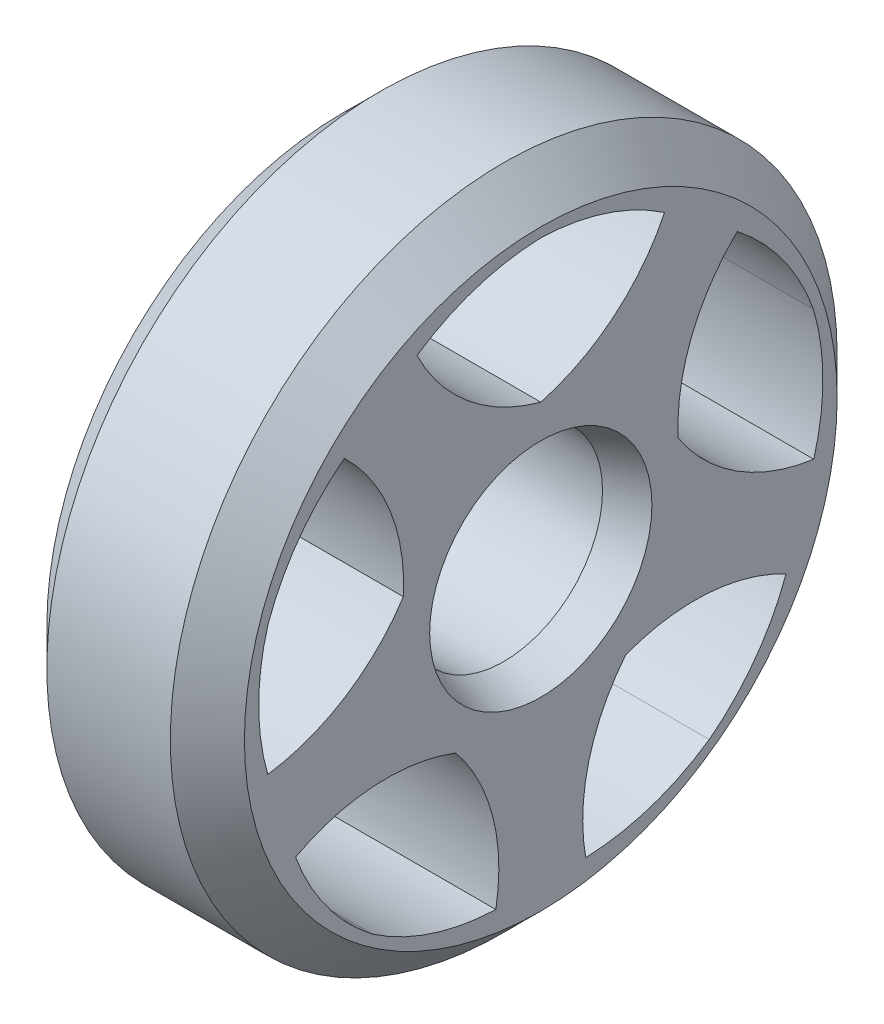
from build123d import *

# Parameters (mm, degrees)
SKETCH1_R           = 13.5
SKETCH1_R_2         = 4
BOSS_EXTRUDE1_DEPTH = 4
CUT_EXTRUDE1_DEPTH  = 20.506409203
CIRPATTERN1_COUNT   = 5
CHAMFER1_SIZE       = 1.5
CHAMFER2_SIZE       = 0.5
CHAMFER2_SIZE2      = 1.5


with BuildPart() as part:
    # Sketch1 → Boss-Extrude1 (new, symmetric)
    with BuildSketch(Plane(origin=(0, 0, 0), x_dir=(0, 0, -1), z_dir=(1, 0, 0))):
        Circle(SKETCH1_R)
        Circle(SKETCH1_R_2, mode=Mode.SUBTRACT)
    extrude(amount=BOSS_EXTRUDE1_DEPTH, both=True)

    # Sketch2 → Cut-Extrude1 (cut, symmetric)
    with BuildSketch(Plane(origin=(0, 0, 0), x_dir=(0, 0, -1), z_dir=(1, 0, 0))):
        with BuildLine():
            ThreePointArc((0, 5.849695328), (-2.956289657, 7.377375059), (-5.012219469, 9.99397715))
            ThreePointArc((-5.012219469, 9.99397715), (-2.621563936, 11.159720287), (0, 11.6087119))
            ThreePointArc((0, 11.6087119), (2.621563936, 11.159720287), (5.012219469, 9.99397715))
            ThreePointArc((5.012219469, 9.99397715), (2.956289657, 7.377375059), (0, 5.849695328))
        make_face()
    cut_extrude1 = extrude(amount=CUT_EXTRUDE1_DEPTH, both=True, mode=Mode.SUBTRACT)

    # CirPattern1: Cut-Extrude1 ×5 about axis
    cirpattern1_axis = Axis((4, 0, 0), (-1, 0, 0))
    for i in range(1, CIRPATTERN1_COUNT):
        add(cut_extrude1.rotate(cirpattern1_axis, i * 360 / CIRPATTERN1_COUNT), mode=Mode.SUBTRACT)

    # Chamfer1
    chamfer1_edges = [part.edges().sort_by_distance(p)[0] for p in [
        (4, 0, 13.5),
        (-4, 0, 13.5),
    ]]
    chamfer(chamfer1_edges, length=CHAMFER1_SIZE)

    # Chamfer2
    chamfer2_edges = [part.edges().sort_by_distance(p)[0] for p in [
        (4, 0, 4),
    ]]
    chamfer2_side = [part.faces().sort_by_distance(p)[0] for p in [
        (4, 0, 11.660588745),
    ]]
    chamfer(chamfer2_edges, length=CHAMFER2_SIZE, length2=CHAMFER2_SIZE2, reference=chamfer2_side[0])


solid = part.part
